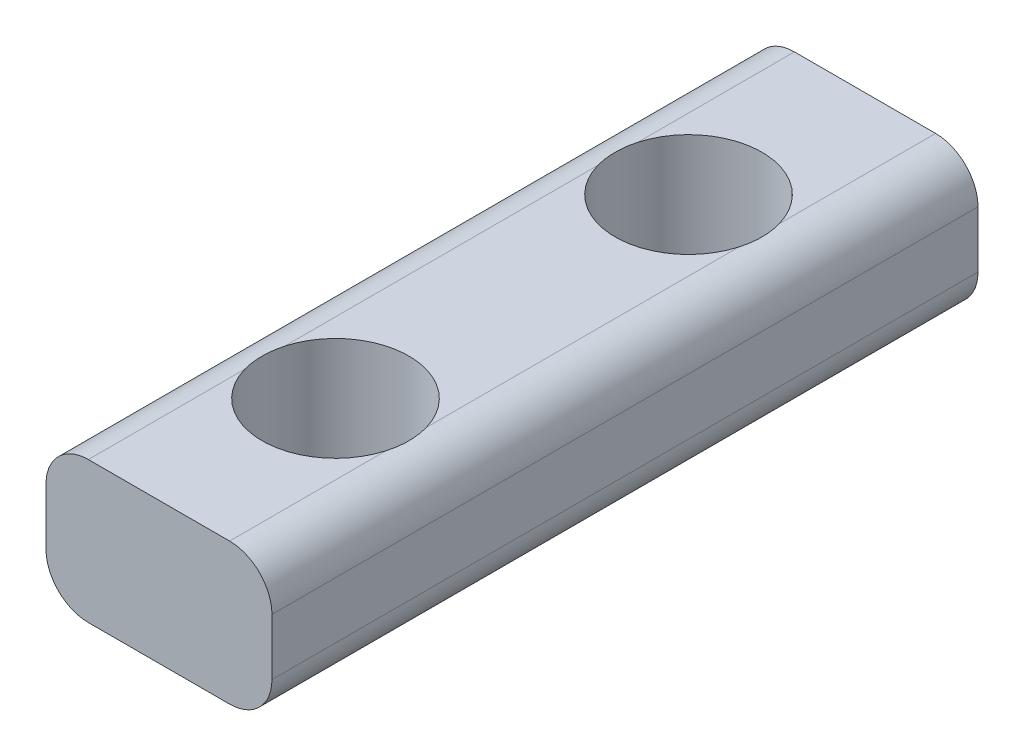
from build123d import *

# Parameters (mm, degrees)
BOSS_EXTRUDE1_DEPTH = 31.75
SKETCH2_R           = 3.302
CUT_EXTRUDE1_DEPTH  = 31.75


with BuildPart() as part:
    # Sketch1 → Boss-Extrude1 (new body)
    with BuildSketch(Plane.XY):
        with BuildLine():
            Line((1.905, 0), (8.255, 0))
            ThreePointArc((8.255, 0), (9.602038418, 0.557961582), (10.16, 1.905))
            Line((10.16, 1.905), (10.16, 4.445))
            ThreePointArc((10.16, 4.445), (9.602038418, 5.792038418), (8.255, 6.35))
            Line((8.255, 6.35), (1.905, 6.35))
            ThreePointArc((1.905, 6.35), (0.557961582, 5.792038418), (0, 4.445))
            Line((0, 4.445), (0, 1.905))
            ThreePointArc((0, 1.905), (0.557961582, 0.557961582), (1.905, 0))
        make_face()
    extrude(amount=BOSS_EXTRUDE1_DEPTH)

    # Sketch2 → Cut-Extrude1 (cut)
    with BuildSketch(Plane(origin=(0, 6.35, 0), x_dir=(1, 0, 0), z_dir=(0, 1, 0))):
        with Locations((5.08, -7.9375)):
            Circle(SKETCH2_R)
        with Locations((5.08, -23.8125)):
            Circle(SKETCH2_R)
    extrude(amount=-CUT_EXTRUDE1_DEPTH, mode=Mode.SUBTRACT)


solid = part.part
